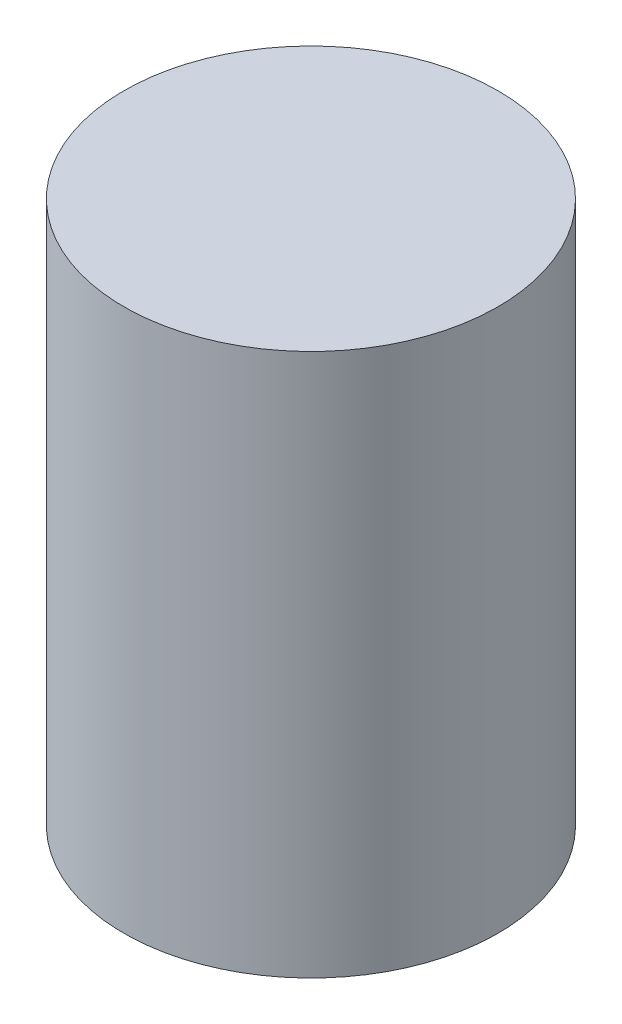
from build123d import *

# Parameters (mm, degrees)
SKETCH1_R           = 31.028783333
BOSS_EXTRUDE1_DEPTH = 90
SKETCH1_5_R         = 26.028783333
CUT_EXTRUDE2_DEPTH  = 85


with BuildPart() as part:
    # Sketch1 → Boss-Extrude1 (new body)
    with BuildSketch(Plane(origin=(0, 0, 0), x_dir=(1, 0, 0), z_dir=(0, 1, 0))):
        Circle(SKETCH1_R)
    extrude(amount=BOSS_EXTRUDE1_DEPTH)

    # Sketch1<5> → Cut-Extrude2 (cut)
    with BuildSketch(Plane(origin=(0, 0, 0), x_dir=(1, 0, 0), z_dir=(0, 1, 0))):
        Circle(SKETCH1_5_R)
    extrude(amount=CUT_EXTRUDE2_DEPTH, mode=Mode.SUBTRACT)


solid = part.part
